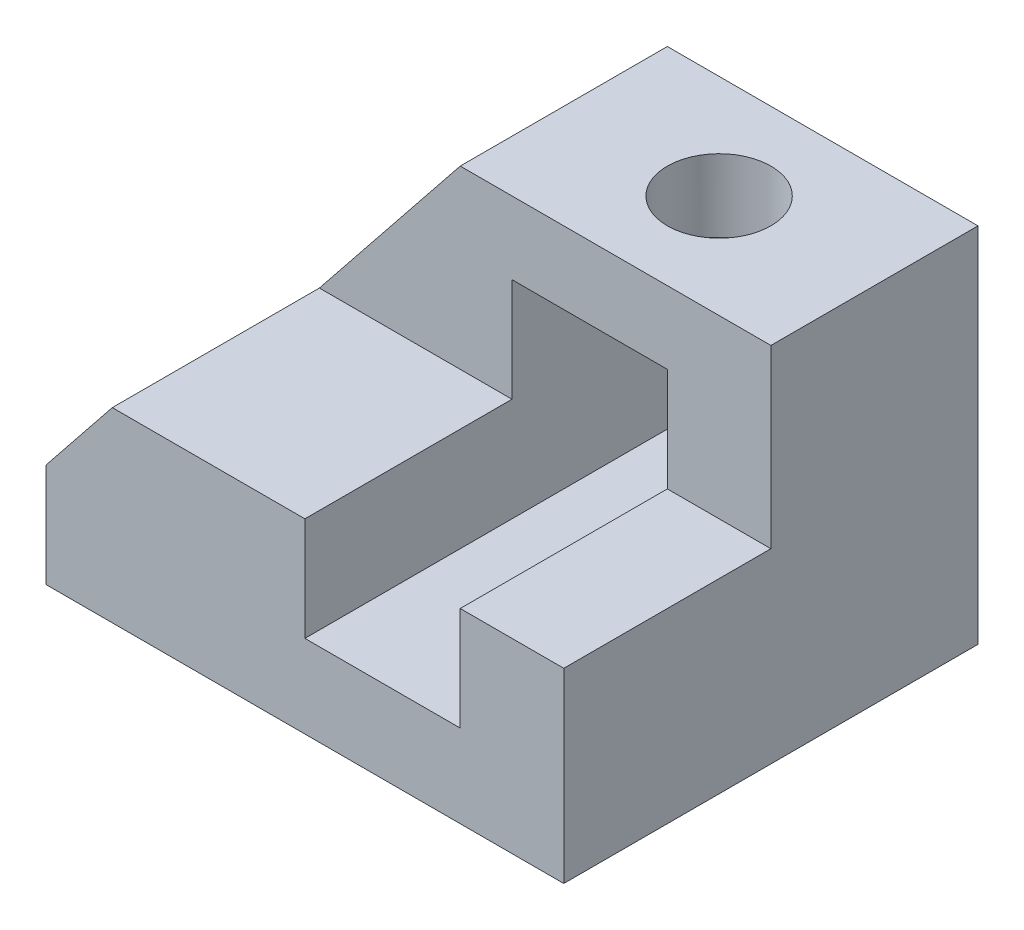
from build123d import *

# Parameters (mm, degrees)
BOSS_EXTRUDE1_DEPTH = 40
BOSS_EXTRUDE2_DEPTH = 20
SKETCH4_R           = 5
CUT_EXTRUDE3_DEPTH  = 20


with BuildPart() as part:
    # Sketch2 → Boss-Extrude1 (new body)
    with BuildSketch(Plane.XY):
        Polygon((0, 10), (0, 0), (50, 0), (50, 18), (40, 18), (40, 8), (25, 8), (25, 18), (6.4, 18), align=None)
    extrude(amount=BOSS_EXTRUDE1_DEPTH)

    # Sketch2<4> → Boss-Extrude2 (add)
    with BuildSketch(Plane.XY):
        Polygon((20, 35), (6.4, 18), (25, 18), (25, 28), (40, 28), (40, 18), (50, 18), (50, 35), align=None)
    extrude(amount=BOSS_EXTRUDE2_DEPTH)

    # Sketch4 → Cut-Extrude3 (cut)
    with BuildSketch(Plane(origin=(0, 35, 0), x_dir=(1, 0, 0), z_dir=(0, 1, 0))):
        with Locations((35, -10)):
            Circle(SKETCH4_R)
    extrude(amount=-CUT_EXTRUDE3_DEPTH, mode=Mode.SUBTRACT)


solid = part.part
